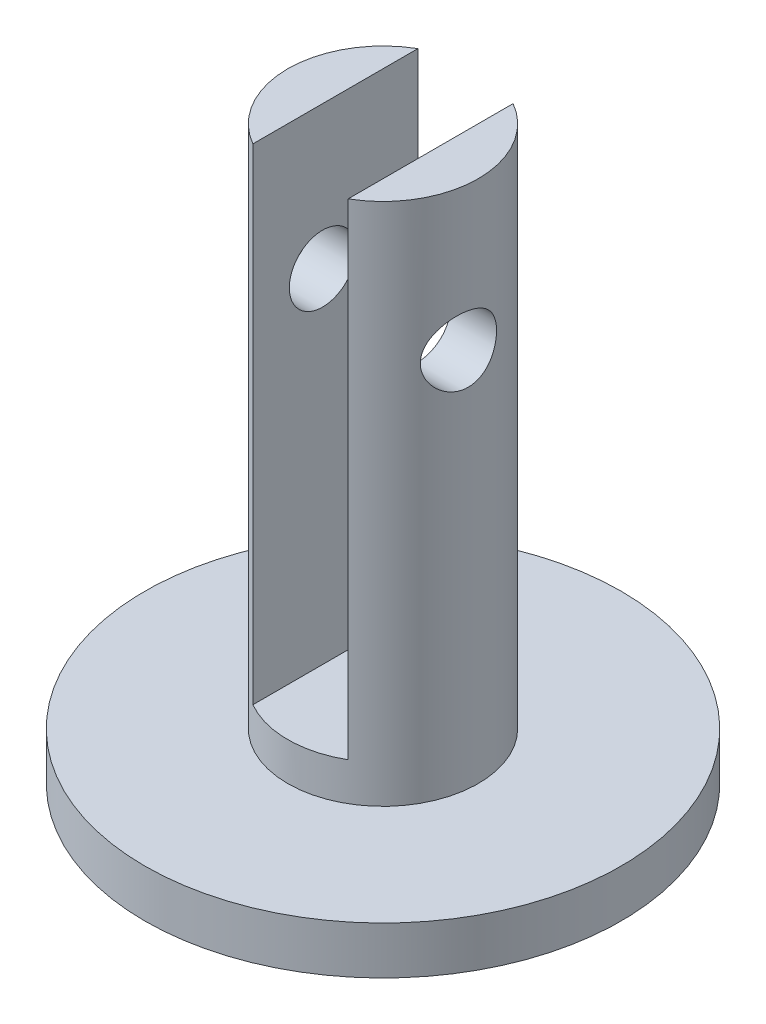
from build123d import *

# Parameters (mm, degrees)
SKETCH1_R           = 10
BOSS_EXTRUDE1_DEPTH = 60
SKETCH1_5_R         = 25
SKETCH1_5_R_2       = 10
BOSS_EXTRUDE3_DEPTH = 5
SKETCH6_W           = 10
SKETCH6_H           = 20
CUT_EXTRUDE2_DEPTH  = 51
CUT_EXTRUDE3_START  = -10.0000001
CUT_EXTRUDE3_DEPTH  = 20.000000175
SKETCH8_W           = 1.5
SKETCH8_H           = 5.5075
SKETCH8_H_2         = 3.4925
SKETCH8_W_2         = 16.5
CUT_EXTRUDE4_DEPTH  = 2
FILLET2_R           = 1.5
FILLET3_R           = 1


# Read off the part's stored shape, not the designer's step: Cut-Extrude3
with BuildPart() as part:
    # Sketch1 → Boss-Extrude1 (new body)
    with BuildSketch(Plane(origin=(0, 0, 0), x_dir=(1, 0, 0), z_dir=(0, 1, 0))):
        with Locations(Location((0, 0, 0), (0, 0, 270))):
            Circle(SKETCH1_R)
    extrude(amount=BOSS_EXTRUDE1_DEPTH)

    # Sketch1<5> → Boss-Extrude3 (add)
    with BuildSketch(Plane(origin=(0, 0, 0), x_dir=(1, 0, 0), z_dir=(0, 1, 0))):
        with Locations(Location((0, 0, 0), (0, 0, 270))):
            Circle(SKETCH1_5_R)
        with Locations(Location((0, 0, 0), (0, 0, 270))):
            Circle(SKETCH1_5_R_2, mode=Mode.SUBTRACT)
    extrude(amount=BOSS_EXTRUDE3_DEPTH)

    # Sketch6 → Cut-Extrude2 (cut)
    with BuildSketch(Plane(origin=(0, 60, 0), x_dir=(1, 0, 0), z_dir=(0, 1, 0))):
        Rectangle(SKETCH6_W, SKETCH6_H)
    extrude(amount=-CUT_EXTRUDE2_DEPTH, mode=Mode.SUBTRACT)

    # Cut-Extrude3 outline → Cut-Extrude3 (cut)
    with BuildSketch(Plane(origin=(0, 0, 0), x_dir=(0, 0, -1), z_dir=(1, 0, 0)).offset(CUT_EXTRUDE3_START)):
        with BuildLine():
            add(Edge.make_bspline(
                [(-4.839745962, 45), (-4.839745962, 44.061427817), (-4.450746498, 43.166577946), (-3.199248606, 41.904517699), (-2.320388043, 41.517275442), (-0.486539081, 41.483884635), (0.452391521, 41.853887629), (1.774975913, 43.153845226), (2.16014876, 44.075410749), (2.16035927, 45.923792027), (1.777989156, 46.84346553), (0.448336969, 48.149824894), (-0.485336071, 48.515908682), (-2.319848282, 48.482962757), (-3.200529308, 48.095220586), (-4.45348427, 46.829628074), (-4.839745962, 45.938572183), (-4.839745962, 45)],
                knots=[0, 0, 0, 0, 0.125, 0.125, 0.25, 0.25, 0.375, 0.375, 0.5, 0.5, 0.625, 0.625, 0.75, 0.75, 0.875, 0.875, 1, 1, 1, 1], degree=3))
        make_face()
    extrude(amount=CUT_EXTRUDE3_DEPTH, mode=Mode.SUBTRACT)

    # Sketch8 → Cut-Extrude4 (cut)
    with BuildSketch(Plane.XZ):
        with Locations((-0.75, -6.24625)):
            Rectangle(SKETCH8_W, SKETCH8_H)
        with Locations((0.75, -6.24625)):
            Rectangle(SKETCH8_W, SKETCH8_H)
        with Locations((0.75, -1.74625)):
            Rectangle(SKETCH8_W, SKETCH8_H_2)
        with Locations((-0.75, -1.74625)):
            Rectangle(SKETCH8_W, SKETCH8_H_2)
        with Locations((9.75, -1.74625)):
            Rectangle(SKETCH8_W_2, SKETCH8_H_2)
        with Locations((9.75, 1.74625)):
            Rectangle(SKETCH8_W_2, SKETCH8_H_2)
        with Locations((0.75, 1.74625)):
            Rectangle(SKETCH8_W, SKETCH8_H_2)
        with Locations((-0.75, 1.74625)):
            Rectangle(SKETCH8_W, SKETCH8_H_2)
        with Locations((0.75, 6.24625)):
            Rectangle(SKETCH8_W, SKETCH8_H)
        with Locations((-0.75, 6.24625)):
            Rectangle(SKETCH8_W, SKETCH8_H)
        with Locations((-9.75, 1.74625)):
            Rectangle(SKETCH8_W_2, SKETCH8_H_2)
        with Locations((-9.75, -1.74625)):
            Rectangle(SKETCH8_W_2, SKETCH8_H_2)
    extrude(amount=-CUT_EXTRUDE4_DEPTH, mode=Mode.SUBTRACT)

    # Fillet2
    fillet2_edges = [part.edges().sort_by_distance(p)[0] for p in [
        (18, 1, 3.4925),
        (18, 1, -3.4925),
        (-18, 1, -3.4925),
        (-18, 1, 3.4925),
    ]]
    fillet(fillet2_edges, radius=FILLET2_R)

    # Fillet3
    fillet3_edges = [part.edges().sort_by_distance(p)[0] for p in [
        (1.5, 1, -9),
        (-1.5, 1, -9),
        (-1.5, 1, 9),
        (1.5, 1, 9),
    ]]
    fillet(fillet3_edges, radius=FILLET3_R)


solid = part.part
